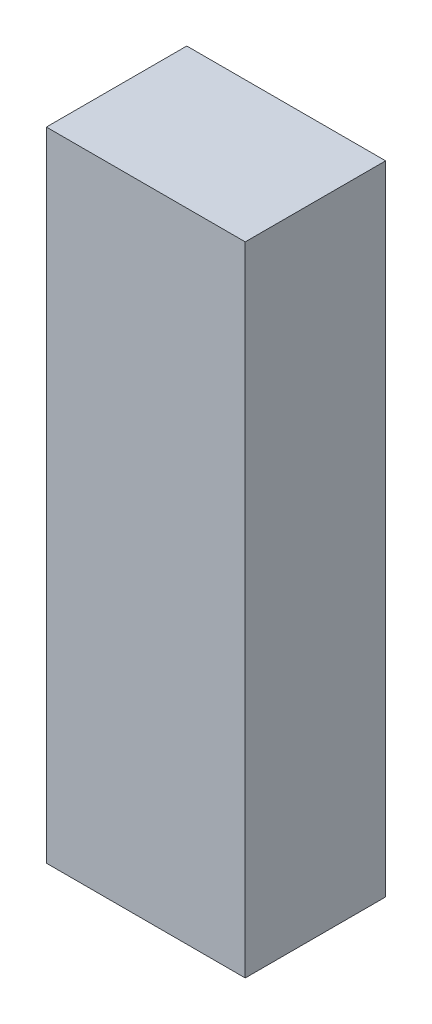
from build123d import *

# Parameters (mm, degrees)
SKETCH1_W           = 34
SKETCH1_H           = 109
BOSS_EXTRUDE1_DEPTH = 24


with BuildPart() as part:
    # Sketch1 → Boss-Extrude1 (new body)
    with BuildSketch(Plane.XY):
        with Locations((-296.749186861, 54.5)):
            Rectangle(SKETCH1_W, SKETCH1_H)
    extrude(amount=BOSS_EXTRUDE1_DEPTH)


solid = part.part
